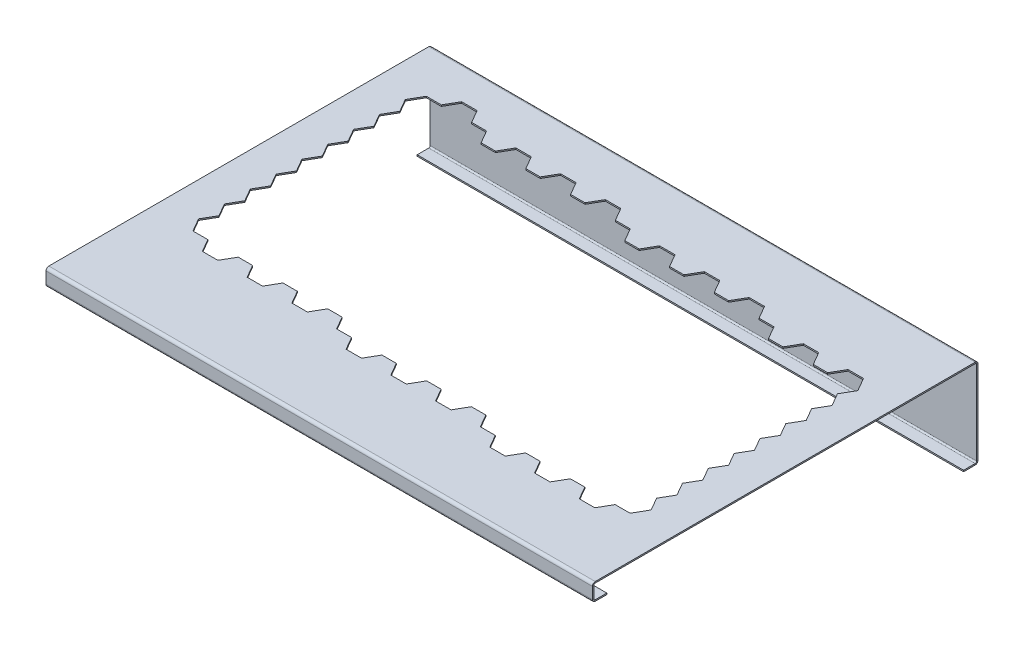
from build123d import *

# Parameters (mm, degrees)
SKETCH1_W                      = 481.838
SKETCH1_H                      = 340.0044
BASE_FLANGE1_DEPTH             = 1.2192
CUT_EXTRUDE1_DEPTH             = 372.395038273
EDGE_FLANGE1_STRIP_W           = 7.4168
EDGE_FLANGE1_STRIP_H           = 1.2192
EDGE_FLANGE1_STRIP_CUT_DEPTH   = 481.838
EDGE_FLANGE1_STRIP_2_W         = 7.4168
EDGE_FLANGE1_STRIP_2_H         = 1.2192
EDGE_FLANGE1_STRIP_CUT_2_DEPTH = 481.838
EDGE_FLANGE1_DEPTH             = 481.838
EDGE_FLANGE1_BEND_DEPTH        = 481.838
EDGE_FLANGE2_STRIP_W           = 7.4168
EDGE_FLANGE2_STRIP_H           = 1.2192
EDGE_FLANGE2_STRIP_CUT_DEPTH   = 481.838
EDGE_FLANGE2_STRIP_2_W         = 7.4168
EDGE_FLANGE2_STRIP_2_H         = 1.2192
EDGE_FLANGE2_STRIP_CUT_2_DEPTH = 481.838
EDGE_FLANGE2_DEPTH             = 481.838
EDGE_FLANGE2_BEND_DEPTH        = 481.838


# Sheet-metal steps are written as plain solids
with BuildPart() as part:
    # Sketch1 → Base-Flange1 (new body)
    with BuildSketch(Plane(origin=(0, 0, 0), x_dir=(1, 0, 0), z_dir=(0, 1, 0))):
        with Locations((-89.281, 0)):
            Rectangle(SKETCH1_W, SKETCH1_H)
    extrude(amount=-BASE_FLANGE1_DEPTH)

    # Sketch4 → Cut-Extrude1 (cut, through all)
    with BuildSketch(Plane(origin=(0, 0, 0), x_dir=(1, 0, 0), z_dir=(0, 1, 0))):
        Polygon((114.842126805, 105.8291), (121.646745743, 94.0435), (115.069436274, 82.6516), (121.646745743, 71.2597), (115.069436274, 59.8678), (121.646745743, 48.4759), (115.069436274, 37.084), (121.646745743, 25.6921), (115.069436274, 14.3002), (121.646745743, 2.9083), (115.069436274, -8.4836), (121.646745743, -19.8755), (115.069436274, -31.2674), (121.646745743, -42.6593), (115.069436274, -54.0512), (121.646745743, -65.4431), (115.069436274, -76.835), (121.646745743, -88.2269), (114.842126805, -100.0125), (101.687446274, -100.0125), (95.110136805, -111.4044), (81.500938938, -111.4044), (74.923629469, -100.0125), (62.223466274, -100.0125), (55.646156805, -111.4044), (42.036958938, -111.4044), (35.459649469, -100.0125), (22.759486274, -100.0125), (16.182176805, -111.4044), (2.572978938, -111.4044), (-4.004330531, -100.0125), (-17.159011062, -100.0125), (-23.736320531, -88.6206), (-36.436483726, -88.6206), (-43.013793195, -100.0125), (-56.622991062, -100.0125), (-63.200300531, -88.6206), (-75.900463726, -88.6206), (-82.477773195, -100.0125), (-96.086971062, -100.0125), (-102.664280531, -88.6206), (-115.364443726, -88.6206), (-121.941753195, -100.0125), (-135.550951062, -100.0125), (-142.128260531, -88.6206), (-155.282941062, -88.6206), (-161.860250531, -77.2287), (-174.560413726, -77.2287), (-181.137723195, -88.6206), (-194.746921062, -88.6206), (-201.324230531, -77.2287), (-214.024393726, -77.2287), (-220.601703195, -88.6206), (-234.210901062, -88.6206), (-240.788210531, -77.2287), (-253.488373726, -77.2287), (-260.065683195, -88.6206), (-273.674881062, -88.6206), (-280.252190531, -77.2287), (-293.397981062, -77.2287), (-300.2026, -65.4431), (-293.625290531, -54.0512), (-300.2026, -42.6593), (-293.625290531, -31.2674), (-300.2026, -19.8755), (-293.625290531, -8.4836), (-300.2026, 2.9083), (-293.625290531, 14.3002), (-300.2026, 25.6921), (-293.625290531, 37.084), (-300.2026, 48.4759), (-293.625290531, 59.8678), (-300.2026, 71.2597), (-293.625290531, 82.6516), (-300.2026, 94.0435), (-293.625290531, 105.4354), (-300.2026, 116.8273), (-293.397981062, 128.6129), (-280.252190531, 128.6129), (-273.674881062, 140.0048), (-260.065683195, 140.0048), (-253.488373726, 128.6129), (-240.333693195, 128.6129), (-233.756383726, 117.221), (-221.056220531, 117.221), (-214.478911062, 128.6129), (-200.869713195, 128.6129), (-194.292403726, 117.221), (-181.592240531, 117.221), (-175.014931062, 128.6129), (-161.405733195, 128.6129), (-154.828423726, 117.221), (-142.128260531, 117.221), (-135.550951062, 128.6129), (-121.941753195, 128.6129), (-115.364443726, 117.221), (-102.209763195, 117.221), (-95.632453726, 105.8291), (-82.932290531, 105.8291), (-76.354981062, 117.221), (-62.745783195, 117.221), (-56.168473726, 105.8291), (-43.468310531, 105.8291), (-36.891001062, 117.221), (-23.281803195, 117.221), (-16.704493726, 105.8291), (-4.004330531, 105.8291), (2.572978938, 117.221), (16.182176805, 117.221), (22.759486274, 105.8291), (35.914166805, 105.8291), (42.491476274, 94.4372), (55.191639469, 94.4372), (61.768948938, 105.8291), (75.378146805, 105.8291), (81.955456274, 94.4372), (94.655619469, 94.4372), (101.232928938, 105.8291), align=None)
    extrude(amount=-CUT_EXTRUDE1_DEPTH, mode=Mode.SUBTRACT)

    # Edge-Flange1 strip (across the edge) → Edge-Flange1 strip cut (cut)
    with BuildSketch(Plane(origin=(-330.2, -1.2192, -170.0022), x_dir=(0, 0, 1), z_dir=(1, 0, 0))):
        with Locations((-1.2192, -0.6096)):
            Rectangle(EDGE_FLANGE1_STRIP_W, EDGE_FLANGE1_STRIP_H)
    extrude(amount=EDGE_FLANGE1_STRIP_CUT_DEPTH, mode=Mode.SUBTRACT)

    # Edge-Flange1 strip 2 (across the edge) → Edge-Flange1 strip cut 2 (cut)
    with BuildSketch(Plane(origin=(151.638, -1.2192, 170.0022), x_dir=(0, 0, -1), z_dir=(-1, 0, 0))):
        with Locations((-1.2192, -0.6096)):
            Rectangle(EDGE_FLANGE1_STRIP_2_W, EDGE_FLANGE1_STRIP_2_H)
    extrude(amount=EDGE_FLANGE1_STRIP_CUT_2_DEPTH, mode=Mode.SUBTRACT)

    # Edge-Flange1 section (across the edge) → Edge-Flange1 (add)
    with BuildSketch(Plane(origin=(-330.2, -1.2192, -170.0022), x_dir=(0, 0, 1), z_dir=(1, 0, 0))):
        with BuildLine():
            Line((0, 1.27), (0, 76.2))
            Line((0, 76.2), (1.2192, 76.2))
            Line((1.2192, 76.2), (1.2192, 1.27))
            ThreePointArc((1.2192, 1.27), (1.591174388, 0.371974388), (2.4892, 0))
            Line((2.4892, 0), (2.4892, -1.2192))
            ThreePointArc((2.4892, -1.2192), (0.7290698, -0.4901302), (0, 1.27))
        make_face()
    extrude(amount=EDGE_FLANGE1_DEPTH)

    # Edge-Flange1 section 2 (across the edge) → Edge-Flange1 bend (add)
    with BuildSketch(Plane(origin=(151.638, -1.2192, 170.0022), x_dir=(0, 0, -1), z_dir=(-1, 0, 0))):
        with BuildLine():
            Line((0, 1.27), (0, 12.7))
            Line((0, 12.7), (1.2192, 12.7))
            Line((1.2192, 12.7), (1.2192, 1.27))
            ThreePointArc((1.2192, 1.27), (1.591174388, 0.371974388), (2.4892, 0))
            Line((2.4892, 0), (2.4892, -1.2192))
            ThreePointArc((2.4892, -1.2192), (0.7290698, -0.4901302), (0, 1.27))
        make_face()
    extrude(amount=EDGE_FLANGE1_BEND_DEPTH)

    # Edge-Flange2 strip (across the edge) → Edge-Flange2 strip cut (cut)
    with BuildSketch(Plane(origin=(-330.2, -77.4192, -168.783), x_dir=(0, 1, 0), z_dir=(1, 0, 0))):
        with Locations((-2.4384, -0.6096)):
            Rectangle(EDGE_FLANGE2_STRIP_W, EDGE_FLANGE2_STRIP_H)
    extrude(amount=EDGE_FLANGE2_STRIP_CUT_DEPTH, mode=Mode.SUBTRACT)

    # Edge-Flange2 strip 2 (across the edge) → Edge-Flange2 strip cut 2 (cut)
    with BuildSketch(Plane(origin=(151.638, -13.9192, 168.783), x_dir=(0, 1, 0), z_dir=(-1, 0, 0))):
        with Locations((-2.4384, -0.6096)):
            Rectangle(EDGE_FLANGE2_STRIP_2_W, EDGE_FLANGE2_STRIP_2_H)
    extrude(amount=EDGE_FLANGE2_STRIP_CUT_2_DEPTH, mode=Mode.SUBTRACT)

    # Edge-Flange2 section (across the edge) → Edge-Flange2 (add)
    with BuildSketch(Plane(origin=(-330.2, -77.4192, -168.783), x_dir=(0, 1, 0), z_dir=(1, 0, 0))):
        with BuildLine():
            Line((-1.2192, 1.27), (-1.2192, 11.4808))
            Line((-1.2192, 11.4808), (0, 11.4808))
            Line((0, 11.4808), (0, 1.27))
            ThreePointArc((0, 1.27), (0.371974388, 0.371974388), (1.27, 0))
            Line((1.27, 0), (1.27, -1.2192))
            ThreePointArc((1.27, -1.2192), (-0.4901302, -0.4901302), (-1.2192, 1.27))
        make_face()
    extrude(amount=EDGE_FLANGE2_DEPTH)

    # Edge-Flange2 section 2 (across the edge) → Edge-Flange2 bend (add)
    with BuildSketch(Plane(origin=(151.638, -13.9192, 168.783), x_dir=(0, 1, 0), z_dir=(-1, 0, 0))):
        with BuildLine():
            Line((-1.2192, 1.27), (-1.2192, 11.4808))
            Line((-1.2192, 11.4808), (0, 11.4808))
            Line((0, 11.4808), (0, 1.27))
            ThreePointArc((0, 1.27), (0.371974388, 0.371974388), (1.27, 0))
            Line((1.27, 0), (1.27, -1.2192))
            ThreePointArc((1.27, -1.2192), (-0.4901302, -0.4901302), (-1.2192, 1.27))
        make_face()
    extrude(amount=EDGE_FLANGE2_BEND_DEPTH)


solid = part.part
